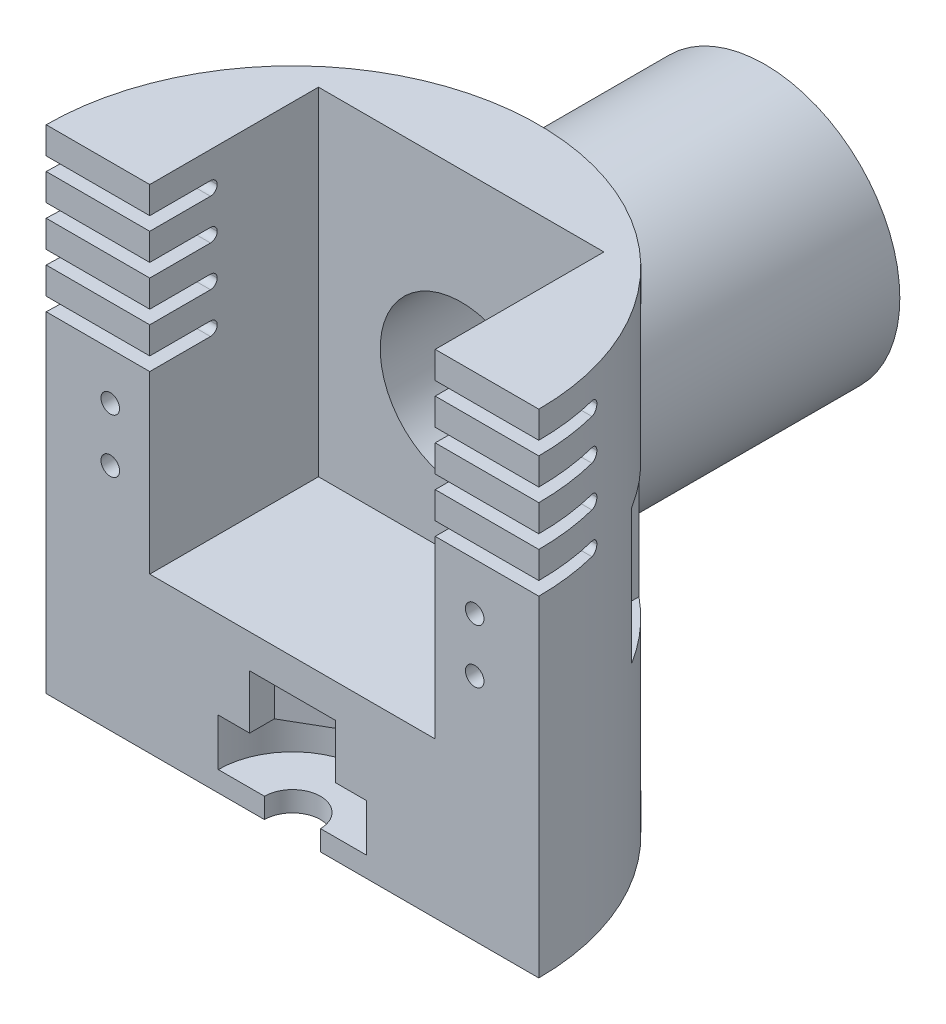
from build123d import *

# Parameters (mm, degrees)
SKETCH1_R                = 36.5
BOSS_EXTRUDE1_DEPTH      = 3
BOSS_EXTRUDE2_DEPTH      = 7
CUT_EXTRUDE1_REACH       = 54.091
SKETCH3_R                = 4.15
BOSS_EXTRUDE3_DEPTH      = 8
SKETCH5_R                = 36.5
BOSS_EXTRUDE4_DEPTH      = 5
SKETCH6_R                = 36.5
SKETCH6_W                = 42.3
SKETCH6_H                = 50
BOSS_EXTRUDE5_DEPTH      = 50
CUT_EXTRUDE3_DEPTH       = 12
BOSS_EXTRUDE6_REACH      = 136.177
BOSS_EXTRUDE6_END_RADIUS = 36.5
SKETCH10_R               = 20
SKETCH8_W                = 73
SKETCH8_H                = 36.5
CUT_EXTRUDE4_DEPTH       = 108.523253466
CUT_EXTRUDE5_REACH       = 95.2
SKETCH9_R                = 4
SKETCH11_R               = 11
CUT_EXTRUDE6_DEPTH       = 7
SKETCH12_R               = 12
CUT_EXTRUDE7_DEPTH       = 35
CUT_EXTRUDE9_REACH       = 104.738
CUT_EXTRUDE9_END_RADIUS  = 36.5
SKETCH13_W               = 8
SKETCH13_H               = 20
CUT_EXTRUDE10_REACH      = 104.738
SKETCH14_R               = 1.375
SKETCH16_R               = 2.65
CUT_EXTRUDE14_DEPTH      = 2.6
SKETCH17_W               = 10
SKETCH17_H               = 2
CUT_EXTRUDE15_DEPTH      = 125.73171226
FILLET1_R                = 1


with BuildPart() as part:
    # Sketch1 → Boss-Extrude1 (new body)
    with BuildSketch(Plane(origin=(0, 0, 0), x_dir=(1, 0, 0), z_dir=(0, 1, 0))):
        with Locations(Location((0, 0, 0), (0, 0, 270))):
            Circle(SKETCH1_R)
    extrude(amount=BOSS_EXTRUDE1_DEPTH)

    # Sketch2 → Boss-Extrude2 (add)
    with BuildSketch(Plane(origin=(0, 3, 0), x_dir=(1, 0, 0), z_dir=(0, 1, 0))):
        with BuildLine():
            Line((-11, 0), (-11, -34.803017111))
            ThreePointArc((-11, -34.803017111), (0, 36.5), (11, -34.803017111))
            Line((11, -34.803017111), (11, 0))
            ThreePointArc((11, 0), (0, 11), (-11, 0))
        make_face()
    extrude(amount=BOSS_EXTRUDE2_DEPTH)

    # Sketch3 → Cut-Extrude1 (cut, up to next)
    with BuildSketch(Plane(origin=(0, 3, 0), x_dir=(1, 0, 0), z_dir=(0, 1, 0)), mode=Mode.PRIVATE) as cut_extrude1_sk1:
        with Locations(Location((0, 0, 0), (0, 0, 270))):
            Circle(SKETCH3_R)
    cut_extrude1_tool1 = extrude(cut_extrude1_sk1.sketch, amount=-CUT_EXTRUDE1_REACH, mode=Mode.PRIVATE) & part.part
    add(cut_extrude1_tool1.solids().sort_by_distance((0, 3, 0))[0], mode=Mode.SUBTRACT)

    # Sketch4 → Boss-Extrude3 (add)
    with BuildSketch(Plane(origin=(0, 10, 0), x_dir=(1, 0, 0), z_dir=(0, 1, 0))):
        with BuildLine():
            Line((-11, -34.803017111), (-11, 0))
            ThreePointArc((-11, 0), (0, 11), (11, 0))
            Line((11, 0), (11, -34.803017111))
            ThreePointArc((11, -34.803017111), (0, 36.5), (-11, -34.803017111))
        make_face()
        with BuildLine():
            Line((-6.35, -35.943392995), (-6.35, -3.666174209))
            Line((-6.35, -3.666174209), (-6.35, 3.666174209))
            Line((-6.35, 3.666174209), (0, 7.332348419))
            Line((0, 7.332348419), (6.35, 3.666174209))
            Line((6.35, 3.666174209), (6.35, -3.666174209))
            Line((6.35, -3.666174209), (6.35, -35.943392995))
            ThreePointArc((6.35, -35.943392995), (8.693718381, -35.449531178), (11, -34.803017111))
            Line((11, -34.803017111), (11, 0))
            ThreePointArc((11, 0), (0, 11), (-11, 0))
            Line((-11, 0), (-11, -34.803017111))
            ThreePointArc((-11, -34.803017111), (-8.693718381, -35.449531178), (-6.35, -35.943392995))
        make_face()
    extrude(amount=BOSS_EXTRUDE3_DEPTH)

    # Sketch5 → Boss-Extrude4 (add)
    with BuildSketch(Plane(origin=(0, 18, 0), x_dir=(1, 0, 0), z_dir=(0, 1, 0))):
        with Locations(Location((0, 0, 0), (0, 0, 270))):
            Circle(SKETCH5_R)
    extrude(amount=BOSS_EXTRUDE4_DEPTH)

    # Sketch6 → Boss-Extrude5 (add)
    with BuildSketch(Plane(origin=(0, 23, 0), x_dir=(1, 0, 0), z_dir=(0, 1, 0))):
        with Locations(Location((0, 0, 0), (0, 0, 270))):
            Circle(SKETCH6_R)
        Rectangle(SKETCH6_W, SKETCH6_H, mode=Mode.SUBTRACT)
    extrude(amount=BOSS_EXTRUDE5_DEPTH)

    # Sketch7 → Cut-Extrude3 (cut)
    with BuildSketch(Plane(origin=(0, 0, 36.5), x_dir=(-1, 0, 0), z_dir=(0, 0, -1))):
        with BuildLine():
            Line((-15.133297532, 2.000141036), (14.866702468, 2.000141036))
            ThreePointArc((14.866702468, 2.000141036), (24.955572938, 11.955409186), (14.955572938, 21.999943586))
            Line((14.955572938, 21.999943586), (-15.044427062, 21.999943586))
            ThreePointArc((-15.044427062, 21.999943586), (-25.044427062, 12.044280534), (-15.133297532, 2.000141036))
        make_face()
    extrude(amount=CUT_EXTRUDE3_DEPTH, mode=Mode.SUBTRACT)

    # Boss-Extrude6: up to this cylinder (the profile starts outside it)
    boss_extrude6_end = Plane(origin=(0, 44, 0), z_dir=(0, -1, 0)) * Cylinder(BOSS_EXTRUDE6_END_RADIUS, 346.354, mode=Mode.PRIVATE)
    # Sketch10 → Boss-Extrude6 (add, up to the surface)
    with BuildSketch(Plane.XY.offset(-70), mode=Mode.PRIVATE) as boss_extrude6_sk1:
        with Locations(Location((0, 44, 0), (0, 0, 90))):
            Circle(SKETCH10_R)
    boss_extrude6_tool1 = extrude(boss_extrude6_sk1.sketch, amount=BOSS_EXTRUDE6_REACH, mode=Mode.PRIVATE) - boss_extrude6_end
    add(boss_extrude6_tool1.solids().sort_by_distance((0, 44, -70))[0])

    # Sketch8 → Cut-Extrude4 (cut, through all)
    with BuildSketch(Plane(origin=(0, 73, 0), x_dir=(1, 0, 0), z_dir=(0, 1, 0))):
        with Locations((0, -18.25)):
            Rectangle(SKETCH8_W, SKETCH8_H)
    extrude(amount=-CUT_EXTRUDE4_DEPTH, mode=Mode.SUBTRACT)

    # Sketch9 → Cut-Extrude5 (cut, up to next)
    with BuildSketch(Plane.XY.offset(-25), mode=Mode.PRIVATE) as cut_extrude5_sk1:
        with Locations((0, 44)):
            Circle(SKETCH9_R)
    cut_extrude5_tool1 = extrude(cut_extrude5_sk1.sketch, amount=-CUT_EXTRUDE5_REACH, mode=Mode.PRIVATE) & part.part
    add(cut_extrude5_tool1.solids().sort_by_distance((0, 44, -25))[0], mode=Mode.SUBTRACT)

    # Sketch11 → Cut-Extrude6 (cut)
    with BuildSketch(Plane(origin=(0, 0, -70), x_dir=(-1, 0, 0), z_dir=(0, 0, -1))):
        with Locations((0, 44)):
            Circle(SKETCH11_R)
    extrude(amount=-CUT_EXTRUDE6_DEPTH, mode=Mode.SUBTRACT)

    # Sketch12 → Cut-Extrude7 (cut)
    with BuildSketch(Plane.XY.offset(-25)):
        with Locations((0, 44)):
            Circle(SKETCH12_R)
    extrude(amount=-CUT_EXTRUDE7_DEPTH, mode=Mode.SUBTRACT)

    # Cut-Extrude9: up to this cylinder (the profile starts inside it)
    cut_extrude9_end = Plane(origin=(0, 38, 0), z_dir=(0, -1, 0)) * Cylinder(CUT_EXTRUDE9_END_RADIUS, 283.476, mode=Mode.PRIVATE)
    # Sketch13 → Cut-Extrude9 (cut, up to the surface)
    with BuildSketch(Plane.XY.offset(-7.6), mode=Mode.PRIVATE) as cut_extrude9_sk1:
        with Locations((-27, 38)):
            Rectangle(SKETCH13_W, SKETCH13_H)
    cut_extrude9_tool1 = extrude(cut_extrude9_sk1.sketch, amount=-CUT_EXTRUDE9_REACH, mode=Mode.PRIVATE) & cut_extrude9_end
    add(cut_extrude9_tool1.solids().sort_by_distance((-27, 38, -7.6))[0], mode=Mode.SUBTRACT)
    # Sketch13 → Cut-Extrude9 (cut, up to the surface)
    with BuildSketch(Plane.XY.offset(-7.6), mode=Mode.PRIVATE) as cut_extrude9_sk2:
        with Locations((27, 38)):
            Rectangle(SKETCH13_W, SKETCH13_H)
    cut_extrude9_tool2 = extrude(cut_extrude9_sk2.sketch, amount=-CUT_EXTRUDE9_REACH, mode=Mode.PRIVATE) & cut_extrude9_end
    add(cut_extrude9_tool2.solids().sort_by_distance((27, 38, -7.6))[0], mode=Mode.SUBTRACT)

    # Sketch14 → Cut-Extrude10 (cut, up to next)
    with BuildSketch(Plane(origin=(0, 0, -7.6), x_dir=(-1, 0, 0), z_dir=(0, 0, -1)), mode=Mode.PRIVATE) as cut_extrude10_sk1:
        with Locations((27, 42)):
            Circle(SKETCH14_R)
    cut_extrude10_tool1 = extrude(cut_extrude10_sk1.sketch, amount=-CUT_EXTRUDE10_REACH, mode=Mode.PRIVATE) & part.part
    # Sketch14 → Cut-Extrude10 (cut, up to next)
    with BuildSketch(Plane(origin=(0, 0, -7.6), x_dir=(-1, 0, 0), z_dir=(0, 0, -1)), mode=Mode.PRIVATE) as cut_extrude10_sk2:
        with Locations((27, 34)):
            Circle(SKETCH14_R)
    cut_extrude10_tool2 = extrude(cut_extrude10_sk2.sketch, amount=-CUT_EXTRUDE10_REACH, mode=Mode.PRIVATE) & part.part
    # Sketch14 → Cut-Extrude10 (cut, up to next)
    with BuildSketch(Plane(origin=(0, 0, -7.6), x_dir=(-1, 0, 0), z_dir=(0, 0, -1)), mode=Mode.PRIVATE) as cut_extrude10_sk3:
        with Locations((-27, 42)):
            Circle(SKETCH14_R)
    cut_extrude10_tool3 = extrude(cut_extrude10_sk3.sketch, amount=-CUT_EXTRUDE10_REACH, mode=Mode.PRIVATE) & part.part
    # Sketch14 → Cut-Extrude10 (cut, up to next)
    with BuildSketch(Plane(origin=(0, 0, -7.6), x_dir=(-1, 0, 0), z_dir=(0, 0, -1)), mode=Mode.PRIVATE) as cut_extrude10_sk4:
        with Locations((-27, 34)):
            Circle(SKETCH14_R)
    cut_extrude10_tool4 = extrude(cut_extrude10_sk4.sketch, amount=-CUT_EXTRUDE10_REACH, mode=Mode.PRIVATE) & part.part
    add(cut_extrude10_tool1.solids().sort_by_distance((-27, 42, -7.6))[0], mode=Mode.SUBTRACT)
    add(cut_extrude10_tool2.solids().sort_by_distance((-27, 34, -7.6))[0], mode=Mode.SUBTRACT)
    add(cut_extrude10_tool3.solids().sort_by_distance((27, 42, -7.6))[0], mode=Mode.SUBTRACT)
    add(cut_extrude10_tool4.solids().sort_by_distance((27, 34, -7.6))[0], mode=Mode.SUBTRACT)

    # Sketch16 → Cut-Extrude14 (cut)
    with BuildSketch(Plane(origin=(0, 0, -7.6), x_dir=(-1, 0, 0), z_dir=(0, 0, -1))):
        with Locations((-27, 42)):
            Circle(SKETCH16_R)
        with Locations((-27, 34)):
            Circle(SKETCH16_R)
        with Locations((27, 42)):
            Circle(SKETCH16_R)
        with Locations((27, 34)):
            Circle(SKETCH16_R)
    extrude(amount=-CUT_EXTRUDE14_DEPTH, mode=Mode.SUBTRACT)

    # Sketch17 → Cut-Extrude15 (cut, through all)
    with BuildSketch(Plane(origin=(36.5, 0, 0), x_dir=(0, 0, -1), z_dir=(1, 0, 0))):
        with Locations((5, 68)):
            Rectangle(SKETCH17_W, SKETCH17_H)
        with Locations((5, 62)):
            Rectangle(SKETCH17_W, SKETCH17_H)
        with Locations((5, 56)):
            Rectangle(SKETCH17_W, SKETCH17_H)
        with Locations((5, 50)):
            Rectangle(SKETCH17_W, SKETCH17_H)
    extrude(amount=-CUT_EXTRUDE15_DEPTH, mode=Mode.SUBTRACT)

    # Fillet1
    fillet1_edges = [part.edges().sort_by_distance(p)[0] for p in [
        (-28.126709318, 49, -10),
        (-28.126709318, 55, -10),
        (-28.126709318, 61, -10),
        (-28.126709318, 67, -10),
        (28.126709318, 67, -10),
        (28.126709318, 61, -10),
        (28.126709318, 55, -10),
        (28.126709318, 49, -10),
        (28.126709318, 51, -10),
        (28.126709318, 57, -10),
        (28.126709318, 63, -10),
        (28.126709318, 69, -10),
        (-28.126709318, 51, -10),
        (-28.126709318, 57, -10),
        (-28.126709318, 63, -10),
        (-28.126709318, 69, -10),
    ]]
    fillet(fillet1_edges, radius=FILLET1_R - 0.0001)  # a hair under: the kernel refuses the full size


solid = part.part
